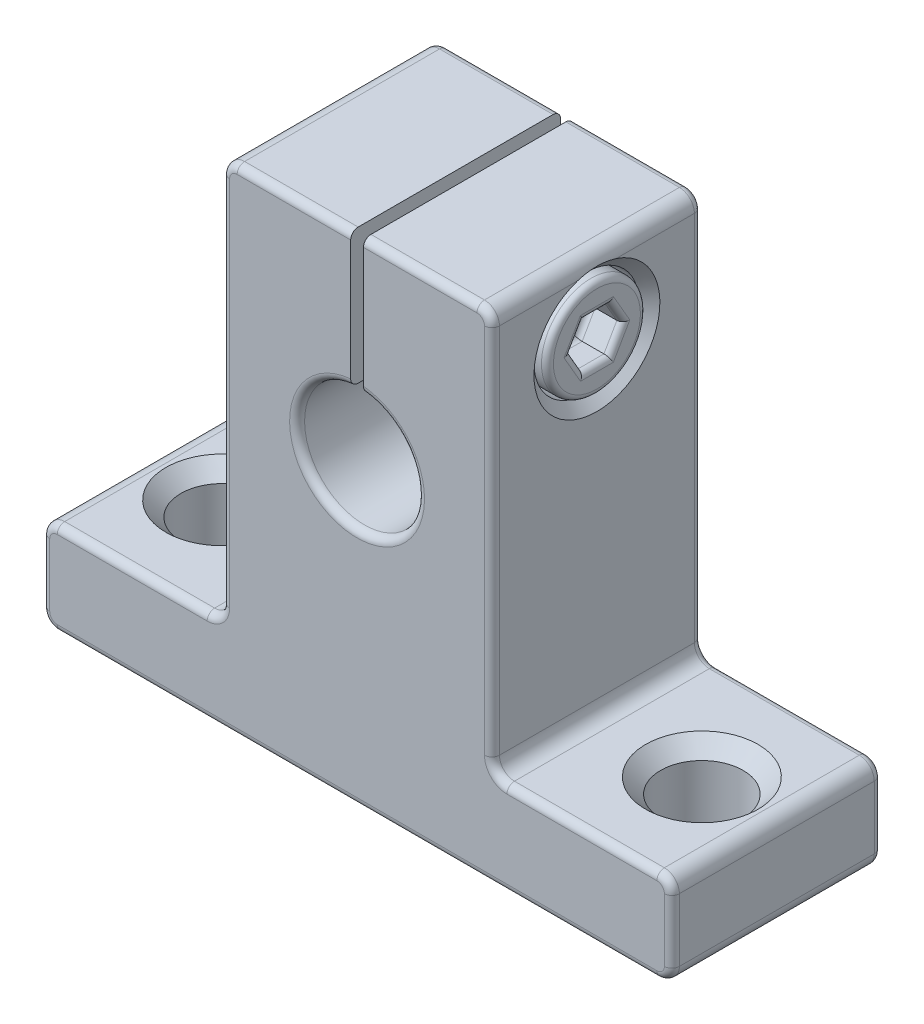
from build123d import *

# Parameters (mm, degrees)
BOSS_EXTRUDE1_DEPTH = 14
CUT_EXTRUDE1_DEPTH  = 42.545156156
SKETCH3_R           = 2.75
CUT_EXTRUDE2_DEPTH  = 6.2
SKETCH5_R           = 3.5
CUT_EXTRUDE3_DEPTH  = 4.5
SKETCH6_R           = 2
CUT_EXTRUDE4_DEPTH  = 44.991476447
CHAMFER1_SIZE       = 1
CHAMFER2_SIZE       = 1.5
CHAMFER3_SIZE       = 0.7
FILLET1_R           = 1
FILLET2_R           = 0.5
SKETCH7_R           = 3.3
BOSS_EXTRUDE2_DEPTH = 4.5
SKETCH8_R           = 1.8
BOSS_EXTRUDE3_DEPTH = 12
CUT_EXTRUDE5_DEPTH  = 2.25
FILLET3_R           = 0.4


with BuildPart() as part:
    # Sketch1 → Boss-Extrude1 (new body)
    with BuildSketch(Plane.XY):
        Polygon((-21, 6.2), (-21, 0), (21, 0), (21, 6.2), (9, 6.2), (9, 33), (-9, 33), (-9, 6.2), align=None)
    extrude(amount=BOSS_EXTRUDE1_DEPTH)

    # Sketch2 → Cut-Extrude1 (cut, through all)
    with BuildSketch(Plane.XY.offset(14)):
        with BuildLine():
            Line((-0.425995721, 23.977251268), (-0.425995721, 33))
            Line((-0.425995721, 33), (0.425995721, 33))
            Line((0.425995721, 33), (0.425995721, 23.977251268))
            ThreePointArc((0.425995721, 23.977251268), (0, 16), (-0.425995721, 23.977251268))
        make_face()
    extrude(amount=-CUT_EXTRUDE1_DEPTH, mode=Mode.SUBTRACT)

    # Sketch3 → Cut-Extrude2 (cut)
    with BuildSketch(Plane.XZ):
        with Locations((-16, 7)):
            Circle(SKETCH3_R)
        with Locations((16, 7)):
            Circle(SKETCH3_R)
    extrude(amount=-CUT_EXTRUDE2_DEPTH, mode=Mode.SUBTRACT)

    # Sketch5 → Cut-Extrude3 (cut)
    with BuildSketch(Plane(origin=(9, 0, 0), x_dir=(0, 0, -1), z_dir=(1, 0, 0))):
        with Locations(Location((-7, 28, 0), (0, 0, 90))):
            Circle(SKETCH5_R)
    extrude(amount=-CUT_EXTRUDE3_DEPTH, mode=Mode.SUBTRACT)

    # Sketch6 → Cut-Extrude4 (cut, through all)
    with BuildSketch(Plane(origin=(4.5, 0, 0), x_dir=(0, 0, -1), z_dir=(1, 0, 0))):
        with Locations(Location((-7, 28, 0), (0, 0, 90))):
            Circle(SKETCH6_R)
    extrude(amount=-CUT_EXTRUDE4_DEPTH, mode=Mode.SUBTRACT)

    # Chamfer1
    chamfer1_edges = [part.edges().sort_by_distance(p)[0] for p in [
        (-18.75, 0, 7),
        (-18.75, 6.2, 7),
        (13.25, 0, 7),
        (13.25, 6.2, 7),
    ]]
    chamfer(chamfer1_edges, length=CHAMFER1_SIZE)

    # Chamfer2
    chamfer2_edges = [part.edges().sort_by_distance(p)[0] for p in [
        (-9, 26, 7),
    ]]
    chamfer(chamfer2_edges, length=CHAMFER2_SIZE)

    # Chamfer3
    chamfer3_edges = [part.edges().sort_by_distance(p)[0] for p in [
        (9, 24.5, 7),
    ]]
    chamfer(chamfer3_edges, length=CHAMFER3_SIZE)

    # Fillet1
    # the kernel refuses this fillet: 1 mm, written as the material it adds along each edge
    with BuildSketch(Plane(origin=(-9, 6.2, 0), x_dir=(-1, 0, 0), z_dir=(0, 0, 1)), Plane(origin=(9, 6.2, 0), x_dir=(0, 1, 0), z_dir=(0, 0, 1))) as fillet1_piece_1:
        with BuildLine():
            CenterArc((FILLET1_R, -FILLET1_R), FILLET1_R, 90, 90)
            Line((0, -FILLET1_R), (0, 0))
            Line((0, 0), (FILLET1_R, 0))
        make_face()
    extrude(amount=14)
    # the kernel refuses this fillet: 1 mm, written as the material it takes off along each edge
    with BuildSketch(Plane(origin=(-9, 33, -2.5), x_dir=(0, -1, 0), z_dir=(0, 0, 1)), Plane(origin=(21, 6.2, -2.5), x_dir=(-1, 0, 0), z_dir=(0, 0, 1)), Plane(origin=(21, 0, -2.5), x_dir=(0, 1, 0), z_dir=(0, 0, 1)), Plane(origin=(-21, 0, -2.5), x_dir=(1, 0, 0), z_dir=(0, 0, 1))) as fillet1_2_piece_1:
        with BuildLine():
            CenterArc((FILLET1_R, FILLET1_R), FILLET1_R, 180, 90)
            Line((0, FILLET1_R), (0, 0))
            Line((0, 0), (FILLET1_R, 0))
        make_face()
    extrude(amount=19, mode=Mode.SUBTRACT)
    with BuildSketch(Plane(origin=(9, 33, -2.5), x_dir=(0, -1, 0), z_dir=(0, 0, 1)), Plane(origin=(-21, 6.2, -2.5), x_dir=(1, 0, 0), z_dir=(0, 0, 1))) as fillet1_2_piece_2:
        with BuildLine():
            CenterArc((FILLET1_R, -FILLET1_R), FILLET1_R, 90, 90)
            Line((0, -FILLET1_R), (0, 0))
            Line((0, 0), (FILLET1_R, 0))
        make_face()
    extrude(amount=19, mode=Mode.SUBTRACT)

    # Fillet2
    fillet2_edges = [part.edges().sort_by_distance(p)[0] for p in [
        (20.707106781, 0.292893219, 14),
        (-20.707106781, 5.907106781, 14),
        (-20.707106781, 0.292893219, 14),
        (-9.292893219, 6.492893219, 0),
        (-9.292893219, 6.492893219, 14),
        (9.292893219, 6.492893219, 0),
        (9.292893219, 6.492893219, 14),
        (-4.21299786, 33, 0),
        (-4.21299786, 33, 14),
        (0, 16, 0),
        (0, 16, 14),
        (0, 0, 0),
        (0, 0, 14),
        (4.21299786, 33, 0),
        (9, 19.6, 0),
        (15, 6.2, 0),
        (21, 3.1, 0),
        (-21, 3.1, 0),
        (-15, 6.2, 0),
        (-9, 19.6, 0),
        (8.707106781, 32.707106781, 0),
        (-8.707106781, 32.707106781, 0),
        (20.707106781, 5.907106781, 0),
        (20.707106781, 0.292893219, 0),
        (-20.707106781, 5.907106781, 0),
        (-20.707106781, 0.292893219, 0),
        (-21, 3.1, 14),
        (-9, 19.6, 14),
        (-15, 6.2, 14),
        (21, 3.1, 14),
        (15, 6.2, 14),
        (9, 19.6, 14),
        (4.21299786, 33, 14),
        (8.707106781, 32.707106781, 14),
        (-8.707106781, 32.707106781, 14),
        (20.707106781, 5.907106781, 14),
    ]]
    fillet(fillet2_edges, radius=FILLET2_R)


with BuildPart() as body_2:
    # Sketch7 → Boss-Extrude2 (new body)
    with BuildSketch(Plane(origin=(4.5, 0, 0), x_dir=(0, 0, -1), z_dir=(1, 0, 0))):
        with Locations(Location((-7, 28, 0), (0, 0, 270))):
            Circle(SKETCH7_R)
    extrude(amount=BOSS_EXTRUDE2_DEPTH)

    # Sketch8 → Boss-Extrude3 (add)
    with BuildSketch(Plane.ZY.offset(-4.5)):
        with Locations(Location((7, 28, 0), (0, 0, 270))):
            Circle(SKETCH8_R)
    extrude(amount=BOSS_EXTRUDE3_DEPTH)

    # Sketch9 → Cut-Extrude5 (cut)
    with BuildSketch(Plane(origin=(9, 0, 0), x_dir=(0, 0, -1), z_dir=(1, 0, 0))):
        Polygon((-7.866025404, 29.5), (-8.732050808, 28), (-7.866025404, 26.5), (-6.133974596, 26.5), (-5.267949192, 28), (-6.133974596, 29.5), align=None)
    extrude(amount=-CUT_EXTRUDE5_DEPTH, mode=Mode.SUBTRACT)

    # Fillet3
    fillet3_edges = [body_2.edges().sort_by_distance(p)[0] for p in [
        (6.75, 29.5, 7),
        (6.75, 28.75, 5.700961894),
        (6.75, 27.25, 5.700961894),
        (6.75, 26.5, 7),
        (6.75, 27.25, 8.299038106),
        (6.75, 28.75, 8.299038106),
        (9, 29.5, 7),
        (9, 28.75, 8.299038106),
        (9, 27.25, 8.299038106),
        (9, 26.5, 7),
        (9, 27.25, 5.700961894),
        (9, 28.75, 5.700961894),
        (9, 31.3, 7),
    ]]
    fillet(fillet3_edges, radius=FILLET3_R)


solid = Compound([part.part, body_2.part])
